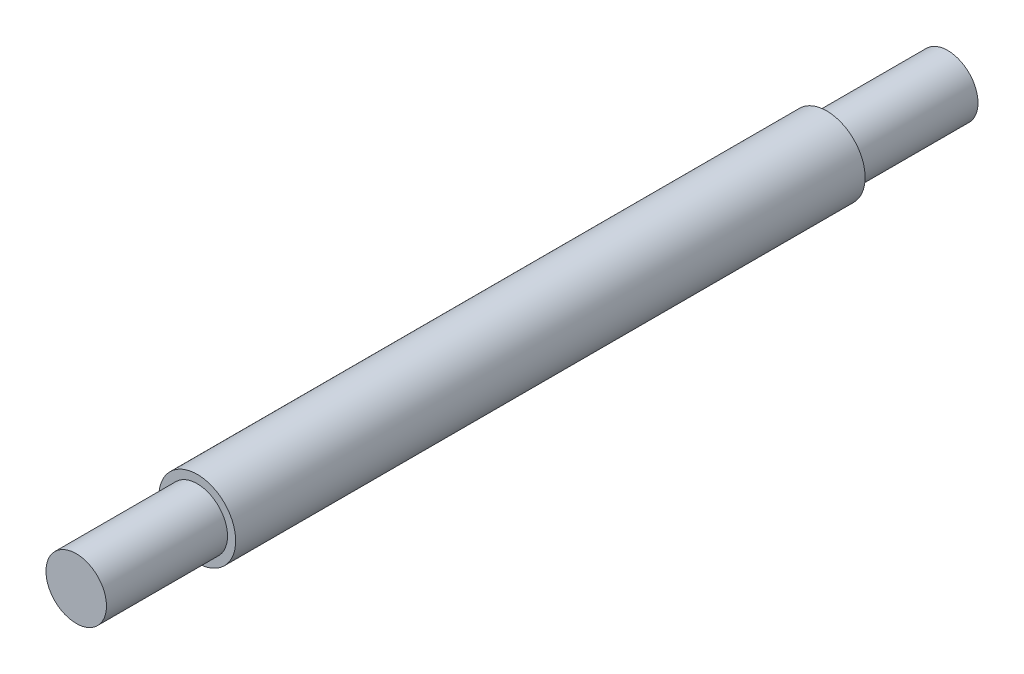
from build123d import *

# Parameters (mm, degrees)
ESBO_O1_R                = 2.5
RESSALTO_EXTRUS_O1_DEPTH = 10
ESBO_O2_R                = 3.175
RESSALTO_EXTRUS_O2_DEPTH = 52
ESBO_O3_R                = 2.5
RESSALTO_EXTRUS_O3_DEPTH = 10


with BuildPart() as part:
    # Esboço1 → Ressalto-extrusão1 (new body)
    with BuildSketch(Plane.XY):
        Circle(ESBO_O1_R)
    extrude(amount=RESSALTO_EXTRUS_O1_DEPTH)

    # Esboço2 → Ressalto-extrusão2 (add)
    with BuildSketch(Plane.XY.offset(10)):
        Circle(ESBO_O2_R)
    extrude(amount=RESSALTO_EXTRUS_O2_DEPTH)

    # Esboço3 → Ressalto-extrusão3 (add)
    with BuildSketch(Plane.XY.offset(62)):
        Circle(ESBO_O3_R)
    extrude(amount=RESSALTO_EXTRUS_O3_DEPTH)


solid = part.part
